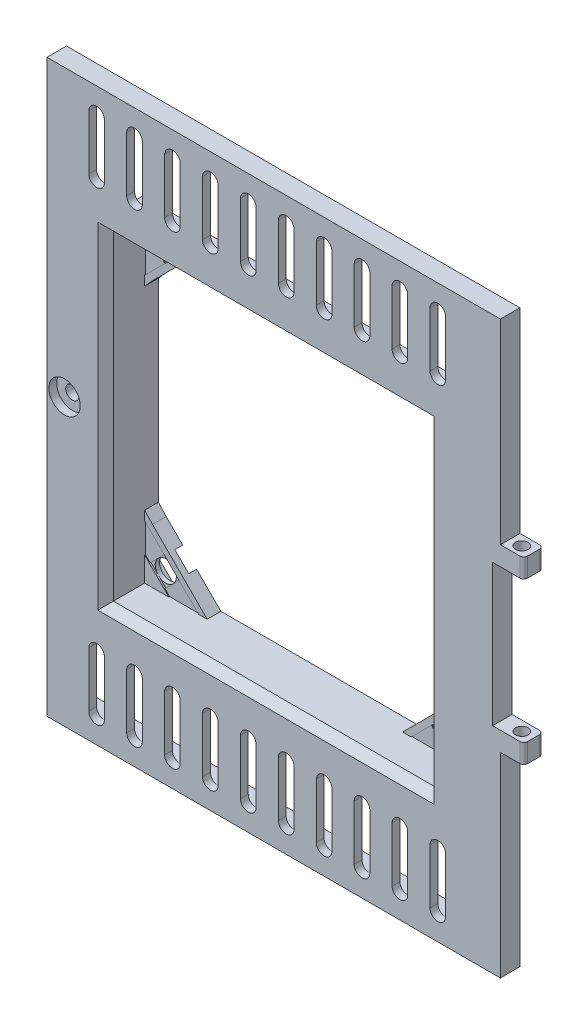
from build123d import *

# Parameters (mm, degrees)
BOSS_EXTRUDE1_DEPTH     = 5
SKETCH2_W               = 5
SKETCH2_H               = 4.9
BOSS_EXTRUDE2_DEPTH     = 6
FILLET1_R               = 1
CUT_EXTRUDE1_DEPTH      = 73
CUT_EXTRUDE1_DEPTH_BACK = 56
SKETCH3_R               = 1.6
SHELL1_START            = 6.108408335
SHELL1_OUTLINE_W        = 112
SHELL1_OUTLINE_H        = 3
SHELL1_DEPTH            = 142
SHELL1_START_2          = 56.108408335
SHELL1_2_DEPTH          = 0.9
SHELL1_START_3          = 97.208408335
SHELL1_3_DEPTH          = 0.9
SKETCH4_R               = 1.7
CUT_EXTRUDE2_DEPTH      = 52
BOSS_EXTRUDE3_START     = 3
SKETCH5_W               = 8
SKETCH5_H               = 10
SKETCH5_R               = 1.7
BOSS_EXTRUDE3_DEPTH     = 3
SKETCH6_R               = 4
CUT_EXTRUDE3_DEPTH      = 2
CHAMFER1_SIZE           = 1
SKETCH7_W               = 86
SKETCH7_H               = 86
SKETCH7_W_2             = 82
SKETCH7_H_2             = 82
BOSS_EXTRUDE4_DEPTH     = 11.5
SKETCH8_R               = 2.7
BOSS_EXTRUDE5_DEPTH     = 3.5
CUT_EXTRUDE4_DEPTH      = 2
CHAMFER2_SIZE           = 5
CHAMFER3_SIZE           = 2
SKETCH10_W              = 82
SKETCH10_H              = 82
CUT_EXTRUDE7_DEPTH      = 2
CHAMFER4_SIZE           = 2
CUT_EXTRUDE8_DEPTH      = 6
SKETCH12_W              = 2
SKETCH12_H              = 54.2
BOSS_EXTRUDE6_DEPTH     = 3
CHAMFER5_SIZE           = 2
CUT_EXTRUDE9_DEPTH      = 12
CUT_EXTRUDE10_DEPTH     = 0.2
CUT_EXTRUDE11_DEPTH     = 0.2
BOSS_EXTRUDE7_DEPTH     = 4


# Read off the part's stored shape, not the designer's step: Shell1
# Some blends are built 0.0001 mm under size
with BuildPart() as part:
    # Sketch1 → Boss-Extrude1 (new body)
    with BuildSketch(Plane.XY.offset(159.876343068)):
        Polygon((73.974778316, 54.108408335), (73.974778316, 4.108408335), (-42.025221684, 4.108408335), (-42.025221684, 150.108408335), (73.974778316, 150.108408335), (73.974778316, 100.108408335), align=None)
    extrude(amount=BOSS_EXTRUDE1_DEPTH)

    # Sketch2 → Boss-Extrude2 (add)
    with BuildSketch(Plane(origin=(73.974778316, 0, 0), x_dir=(0, 0, -1), z_dir=(1, 0, 0))):
        with Locations((-162.376343068, 97.658408335)):
            Rectangle(SKETCH2_W, SKETCH2_H)
        with Locations((-162.376343068, 56.558408335)):
            Rectangle(SKETCH2_W, SKETCH2_H)
    extrude(amount=BOSS_EXTRUDE2_DEPTH)

    # Fillet1
    fillet1_edges = [part.edges().sort_by_distance(p)[0] for p in [
        (79.974778316, 97.658408335, 164.876343068),
        (79.974778316, 97.658408335, 159.876343068),
        (73.974778316, 77.108408335, 159.876343068),
        (73.974778316, 77.108408335, 164.876343068),
        (79.974778316, 56.558408335, 164.876343068),
        (79.974778316, 56.558408335, 159.876343068),
    ]]
    fillet(fillet1_edges, radius=FILLET1_R)

    # Sketch3 → Cut-Extrude1 (cut, two sides: drawn at the far end of the back side and taken through both)
    with BuildSketch(Plane(origin=(0, 95.208408335, 0), x_dir=(-1, 0, 0), z_dir=(0, -1, 0)).offset(-CUT_EXTRUDE1_DEPTH_BACK)):
        with Locations(Location((-76.974778316, -162.376343068, 0), (0, 0, 270))):
            Circle(SKETCH3_R)
    extrude(amount=CUT_EXTRUDE1_DEPTH + CUT_EXTRUDE1_DEPTH_BACK, mode=Mode.SUBTRACT)

    # Shell1 outline → Shell1 (cut)
    with BuildSketch(Plane(origin=(0, 0, 0), x_dir=(1, 0, 0), z_dir=(0, 1, 0)).offset(SHELL1_START)):
        with Locations((15.974778316, -161.376343068)):
            Rectangle(SHELL1_OUTLINE_W, SHELL1_OUTLINE_H)
    extrude(amount=SHELL1_DEPTH, mode=Mode.SUBTRACT)

    # Shell1 2 outline → Shell1 2 (cut)
    with BuildSketch(Plane(origin=(0, 0, 0), x_dir=(1, 0, 0), z_dir=(0, 1, 0)).offset(SHELL1_START_2)):
        with BuildLine():
            Line((74.384411547, -159.876343068), (71.974778316, -159.876343068))
            Line((71.974778316, -159.876343068), (71.974778316, -162.876343068))
            Line((71.974778316, -162.876343068), (73.409669622, -162.876343068))
            ThreePointArc((73.409669622, -162.876343068), (73.5509691, -161.263899606), (74.384411547, -159.876343068))
        make_face()
    extrude(amount=SHELL1_2_DEPTH, mode=Mode.SUBTRACT)

    # Shell1 3 outline → Shell1 3 (cut)
    with BuildSketch(Plane(origin=(0, 0, 0), x_dir=(1, 0, 0), z_dir=(0, 1, 0)).offset(SHELL1_START_3)):
        with BuildLine():
            Line((74.384411547, -159.876343068), (71.974778316, -159.876343068))
            Line((71.974778316, -159.876343068), (71.974778316, -162.876343068))
            Line((71.974778316, -162.876343068), (73.409669622, -162.876343068))
            ThreePointArc((73.409669622, -162.876343068), (73.5509691, -161.263899606), (74.384411547, -159.876343068))
        make_face()
    extrude(amount=SHELL1_3_DEPTH, mode=Mode.SUBTRACT)

    # Sketch4 → Cut-Extrude2 (cut)
    with BuildSketch(Plane(origin=(0, 0, 162.876343068), x_dir=(-1, 0, 0), z_dir=(0, 0, -1))):
        with Locations((37.525221684, 77.108408335)):
            Circle(SKETCH4_R)
    extrude(amount=-CUT_EXTRUDE2_DEPTH, mode=Mode.SUBTRACT)

    # Sketch5 → Boss-Extrude3 (add)
    with BuildSketch(Plane(origin=(0, 0, 162.876343068), x_dir=(-1, 0, 0), z_dir=(0, 0, -1)).offset(BOSS_EXTRUDE3_START)):
        with Locations((36.025221684, 77.108408335)):
            Rectangle(SKETCH5_W, SKETCH5_H)
        with Locations((37.525221684, 77.108408335)):
            Circle(SKETCH5_R, mode=Mode.SUBTRACT)
    extrude(amount=-BOSS_EXTRUDE3_DEPTH)

    # Sketch6 → Cut-Extrude3 (cut)
    with BuildSketch(Plane.XY.offset(164.876343068)):
        with Locations((-37.525221684, 77.108408335)):
            Circle(SKETCH6_R)
    extrude(amount=-CUT_EXTRUDE3_DEPTH, mode=Mode.SUBTRACT)

    # Chamfer1
    chamfer1_edges = [part.edges().sort_by_distance(p)[0] for p in [
        (-40.025221684, 72.108408335, 161.376343068),
        (-40.025221684, 82.108408335, 161.376343068),
        (-32.025221684, 82.108408335, 161.376343068),
        (-32.025221684, 72.108408335, 161.376343068),
    ]]
    chamfer(chamfer1_edges, length=CHAMFER1_SIZE)

    # Sketch7 → Boss-Extrude4 (add)
    with BuildSketch(Plane(origin=(0, 0, 162.876343068), x_dir=(-1, 0, 0), z_dir=(0, 0, -1))):
        with Locations((-13.974778316, 77.108408335)):
            Rectangle(SKETCH7_W, SKETCH7_H)
        with Locations((-13.974778316, 77.108408335)):
            Rectangle(SKETCH7_W_2, SKETCH7_H_2, mode=Mode.SUBTRACT)
    extrude(amount=BOSS_EXTRUDE4_DEPTH)

    # Sketch8 → Boss-Extrude5 (add)
    # profile 1 of 4: a face of its own
    with BuildSketch(Plane(origin=(0, 0, 151.376343068), x_dir=(-1, 0, 0), z_dir=(0, 0, -1))):
        Polygon((-54.974778316, 118.108408335), (-40.974778316, 118.108408335), (-38.974778316, 118.108408335), (-40.974778316, 116.108408335), (-52.974778316, 104.108408335), (-54.974778316, 102.108408335), (-54.974778316, 104.108408335), align=None)
        with Locations((-49.974778316, 113.108408335)):
            Circle(SKETCH8_R, mode=Mode.SUBTRACT)
    # profile 2 of 4: a face of its own
    with BuildSketch(Plane(origin=(0, 0, 151.376343068), x_dir=(-1, 0, 0), z_dir=(0, 0, -1))):
        Polygon((25.025221684, 104.108408335), (13.025221684, 116.108408335), (11.025221684, 118.108408335), (13.025221684, 118.108408335), (27.025221684, 118.108408335), (27.025221684, 104.108408335), (27.025221684, 101.897049153), align=None)
        with Locations(Location((22.025221684, 113.108408335, 0), (0, 0, 180))):
            Circle(SKETCH8_R, mode=Mode.SUBTRACT)
    # profile 3 of 4: a face of its own
    with BuildSketch(Plane(origin=(0, 0, 151.376343068), x_dir=(-1, 0, 0), z_dir=(0, 0, -1))):
        Polygon((27.025221684, 36.108408335), (27.025221684, 50.108408335), (27.025221684, 52.27376362), (25.025221684, 50.108408335), (13.025221684, 38.108408335), (11.025221684, 36.108408335), (13.025221684, 36.108408335), align=None)
        with Locations((22.025221684, 41.108408335)):
            Circle(SKETCH8_R, mode=Mode.SUBTRACT)
    # profile 4 of 4: a face of its own
    with BuildSketch(Plane(origin=(0, 0, 151.376343068), x_dir=(-1, 0, 0), z_dir=(0, 0, -1))):
        Polygon((-52.974778316, 50.108408335), (-40.974778316, 38.108408335), (-38.974778316, 36.108408335), (-40.974778316, 36.108408335), (-54.974778316, 36.108408335), (-54.974778316, 50.108408335), (-54.974778316, 52.108408335), align=None)
        with Locations(Location((-49.974778316, 41.108408335, 0), (0, 0, 180))):
            Circle(SKETCH8_R, mode=Mode.SUBTRACT)
    extrude(amount=-BOSS_EXTRUDE5_DEPTH)

    # Sketch9 → Cut-Extrude4 (cut)
    with BuildSketch(Plane(origin=(0, 0, 151.376343068), x_dir=(-1, 0, 0), z_dir=(0, 0, -1))):
        Polygon((-46.463843018, 116.619343633), (-51.259869826, 117.904435143), (-54.770805124, 114.393499845), (-53.485713614, 109.597473037), (-48.689686806, 108.312381527), (-45.178751508, 111.823316825), align=None)
        Polygon((17.229194876, 111.823316825), (18.514286386, 116.619343633), (23.310313194, 117.904435143), (26.821248492, 114.393499845), (25.536156982, 109.597473037), (20.740130174, 108.312381527), align=None)
        Polygon((18.514286386, 37.597473037), (23.310313194, 36.312381527), (26.821248492, 39.823316825), (25.536156982, 44.619343633), (20.740130174, 45.904435143), (17.229194876, 42.393499845), align=None)
        Polygon((-45.178751508, 42.393499845), (-46.463843018, 37.597473037), (-51.259869826, 36.312381527), (-54.770805124, 39.823316825), (-53.485713614, 44.619343633), (-48.689686806, 45.904435143), align=None)
    extrude(amount=-CUT_EXTRUDE4_DEPTH, mode=Mode.SUBTRACT)

    # Chamfer2
    # the kernel refuses this chamfer: 5 mm, written as the material it adds along each edge
    with BuildSketch(Plane(origin=(56.974778316, 120.108408335, 162.876343068), x_dir=(0, 0.9996219169127715, 0.02749587655697328), z_dir=(-1, 0, 0)), Plane(origin=(-29.025221684, 120.108408335, 162.876343068), x_dir=(-0.9996219169127715, 0, 0.027495876556973334), z_dir=(0, -1, 0)), Plane(origin=(56.974778316, 34.108408335, 162.876343068), x_dir=(0.9996219169127715, 0, 0.027495876556973355), z_dir=(0, 1, 0)), Plane(origin=(-29.025221684, 34.108408335, 162.876343068), x_dir=(0, -0.9996219169127715, 0.027495876556973334), z_dir=(1, 0, 0))) as chamfer2_piece_1:
        Polygon((CHAMFER2_SIZE * 0.999621916911, CHAMFER2_SIZE * 0.0274958766114), (-CHAMFER2_SIZE * 0.027495876557, CHAMFER2_SIZE * 0.999621916913), (0, 0), align=None)
    extrude(amount=86)
    with BuildSketch(Plane(origin=(56.974778316, 34.108408335, 162.876343068), x_dir=(0.9996219169127715, 0, 0.027495876556973355), z_dir=(0, 1, 0))) as chamfer2_piece_2a_section:
        Polygon((CHAMFER2_SIZE * 0.999621916911, CHAMFER2_SIZE * 0.0274958766114), (-CHAMFER2_SIZE * 0.027495876557, CHAMFER2_SIZE * 0.999621916913), (0, 0), align=None)
    chamfer2_piece_2a = extrude(amount=98.85841494, mode=Mode.PRIVATE)
    chamfer2_piece_2a = split(chamfer2_piece_2a, bisect_by=Plane(origin=(58.62374645, 120.108408335, 161.227374934), z_dir=(0, 1, 0)), keep=Keep.TOP, mode=Mode.PRIVATE)
    with BuildSketch(Plane(origin=(69.833193256, 120.108408335, 162.876343068), x_dir=(0, 0.9996219169112968, 0.027495876610587663), z_dir=(-1, 0, 0))) as chamfer2_piece_2b_section:
        Polygon((CHAMFER2_SIZE * 0.999621916911, CHAMFER2_SIZE * 0.0274958766106), (-CHAMFER2_SIZE * 0.0274958766106, CHAMFER2_SIZE * 0.999621916911), (0, 0), align=None)
    chamfer2_piece_2b = extrude(amount=98.85841494, mode=Mode.PRIVATE)
    chamfer2_piece_2b = split(chamfer2_piece_2b, bisect_by=Plane(origin=(56.974778316, 121.757376469, 161.227374934), z_dir=(1, 0, 0)), keep=Keep.TOP, mode=Mode.PRIVATE)
    chamfer2_piece_2 = chamfer2_piece_2a & chamfer2_piece_2b
    add(chamfer2_piece_2)
    with BuildSketch(Plane(origin=(-29.025221684, 132.966823275, 162.876343068), x_dir=(-0.9996219169112968, 0, 0.02749587661058768), z_dir=(0, -1, 0))) as chamfer2_piece_3a_section:
        Polygon((CHAMFER2_SIZE * 0.999621916911, CHAMFER2_SIZE * 0.0274958766106), (-CHAMFER2_SIZE * 0.0274958766106, CHAMFER2_SIZE * 0.999621916911), (0, 0), align=None)
    chamfer2_piece_3a = extrude(amount=98.85841494, mode=Mode.PRIVATE)
    chamfer2_piece_3a = split(chamfer2_piece_3a, bisect_by=Plane(origin=(-30.674189818, 120.108408335, 161.227374934), z_dir=(0, 1, 0)), keep=Keep.TOP, mode=Mode.PRIVATE)
    with BuildSketch(Plane(origin=(56.974778316, 120.108408335, 162.876343068), x_dir=(0, 0.9996219169127715, 0.02749587655697328), z_dir=(-1, 0, 0))) as chamfer2_piece_3b_section:
        Polygon((CHAMFER2_SIZE * 0.999621916911, CHAMFER2_SIZE * 0.0274958766114), (-CHAMFER2_SIZE * 0.027495876557, CHAMFER2_SIZE * 0.999621916913), (0, 0), align=None)
    chamfer2_piece_3b = extrude(amount=98.85841494, mode=Mode.PRIVATE)
    chamfer2_piece_3b = split(chamfer2_piece_3b, bisect_by=Plane(origin=(-29.025221684, 121.757376469, 161.227374934), z_dir=(-1, 0, 0)), keep=Keep.TOP, mode=Mode.PRIVATE)
    chamfer2_piece_3 = chamfer2_piece_3a & chamfer2_piece_3b
    add(chamfer2_piece_3)
    with BuildSketch(Plane(origin=(-41.883636624, 34.108408335, 162.876343068), x_dir=(0, -0.9996219169112968, 0.0274958766105877), z_dir=(1, 0, 0))) as chamfer2_piece_4a_section:
        Polygon((CHAMFER2_SIZE * 0.999621916911, CHAMFER2_SIZE * 0.0274958766106), (-CHAMFER2_SIZE * 0.0274958766106, CHAMFER2_SIZE * 0.999621916911), (0, 0), align=None)
    chamfer2_piece_4a = extrude(amount=98.85841494, mode=Mode.PRIVATE)
    chamfer2_piece_4a = split(chamfer2_piece_4a, bisect_by=Plane(origin=(-29.025221684, 32.459440201, 161.227374934), z_dir=(-1, 0, 0)), keep=Keep.TOP, mode=Mode.PRIVATE)
    with BuildSketch(Plane(origin=(-29.025221684, 120.108408335, 162.876343068), x_dir=(-0.9996219169127715, 0, 0.027495876556973334), z_dir=(0, -1, 0))) as chamfer2_piece_4b_section:
        Polygon((CHAMFER2_SIZE * 0.999621916911, CHAMFER2_SIZE * 0.0274958766114), (-CHAMFER2_SIZE * 0.027495876557, CHAMFER2_SIZE * 0.999621916913), (0, 0), align=None)
    chamfer2_piece_4b = extrude(amount=98.85841494, mode=Mode.PRIVATE)
    chamfer2_piece_4b = split(chamfer2_piece_4b, bisect_by=Plane(origin=(-30.674189818, 34.108408335, 161.227374934), z_dir=(0, -1, 0)), keep=Keep.TOP, mode=Mode.PRIVATE)
    chamfer2_piece_4 = chamfer2_piece_4a & chamfer2_piece_4b
    add(chamfer2_piece_4)
    with BuildSketch(Plane(origin=(56.974778316, 21.249993395, 162.876343068), x_dir=(0.9996219169112968, 0, 0.0274958766105877), z_dir=(0, 1, 0))) as chamfer2_piece_5a_section:
        Polygon((CHAMFER2_SIZE * 0.999621916911, CHAMFER2_SIZE * 0.0274958766106), (-CHAMFER2_SIZE * 0.0274958766106, CHAMFER2_SIZE * 0.999621916911), (0, 0), align=None)
    chamfer2_piece_5a = extrude(amount=98.85841494, mode=Mode.PRIVATE)
    chamfer2_piece_5a = split(chamfer2_piece_5a, bisect_by=Plane(origin=(58.62374645, 34.108408335, 161.227374934), z_dir=(0, -1, 0)), keep=Keep.TOP, mode=Mode.PRIVATE)
    with BuildSketch(Plane(origin=(-29.025221684, 34.108408335, 162.876343068), x_dir=(0, -0.9996219169127715, 0.027495876556973334), z_dir=(1, 0, 0))) as chamfer2_piece_5b_section:
        Polygon((CHAMFER2_SIZE * 0.999621916911, CHAMFER2_SIZE * 0.0274958766114), (-CHAMFER2_SIZE * 0.027495876557, CHAMFER2_SIZE * 0.999621916913), (0, 0), align=None)
    chamfer2_piece_5b = extrude(amount=98.85841494, mode=Mode.PRIVATE)
    chamfer2_piece_5b = split(chamfer2_piece_5b, bisect_by=Plane(origin=(56.974778316, 32.459440201, 161.227374934), z_dir=(1, 0, 0)), keep=Keep.TOP, mode=Mode.PRIVATE)
    chamfer2_piece_5 = chamfer2_piece_5a & chamfer2_piece_5b
    add(chamfer2_piece_5)

    # Chamfer3
    chamfer3_edges = [part.edges().sort_by_distance(p)[0] for p in [
        (56.974778316, 77.108408335, 151.376343068),
        (13.974778316, 34.108408335, 151.376343068),
        (-29.025221684, 77.108408335, 151.376343068),
        (13.974778316, 120.108408335, 151.376343068),
    ]]
    chamfer(chamfer3_edges, length=CHAMFER3_SIZE - 0.0001)  # a hair under: the kernel refuses the full size

    # Sketch10 → Cut-Extrude7 (cut)
    with BuildSketch(Plane.XY.offset(164.876343068)):
        with Locations((13.974778316, 77.108408335)):
            Rectangle(SKETCH10_W, SKETCH10_H)
    extrude(amount=-CUT_EXTRUDE7_DEPTH, mode=Mode.SUBTRACT)

    # Chamfer4
    chamfer4_edges = [part.edges().sort_by_distance(p)[0] for p in [
        (54.974778316, 77.108408335, 164.876343068),
        (13.974778316, 118.108408335, 164.876343068),
        (-27.025221684, 77.108408335, 164.876343068),
        (13.974778316, 36.108408335, 164.876343068),
    ]]
    chamfer(chamfer4_edges, length=CHAMFER4_SIZE)

    # Sketch11 → Cut-Extrude8 (cut, symmetric)
    with BuildSketch(Plane(origin=(0, 0, 162.876343068), x_dir=(-1, 0, 0), z_dir=(0, 0, -1))):
        Polygon((-75.974778316, 95.208408335), (-72.974778316, 95.208408335), (-71.974778316, 95.208408335), (-71.974778316, 59.008408335), (-73.474778316, 59.008408335), (-75.974778316, 59.008408335), align=None)
    extrude(amount=CUT_EXTRUDE8_DEPTH, both=True, mode=Mode.SUBTRACT)

    # Sketch12 → Boss-Extrude6 (add)
    with BuildSketch(Plane(origin=(0, 0, 162.876343068), x_dir=(-1, 0, 0), z_dir=(0, 0, -1))):
        with Locations((-70.974778316, 77.008408335)):
            Rectangle(SKETCH12_W, SKETCH12_H)
    extrude(amount=BOSS_EXTRUDE6_DEPTH)

    # Chamfer5
    chamfer5_edges = [part.edges().sort_by_distance(p)[0] for p in [
        (71.974778316, 104.108408335, 161.376343068),
        (71.974778316, 49.908408335, 161.376343068),
    ]]
    chamfer(chamfer5_edges, length=CHAMFER5_SIZE - 0.0001)  # a hair under: the kernel refuses the full size

    # Sketch13 → Cut-Extrude9 (cut)
    with BuildSketch(Plane(origin=(0, 0, 162.876343068), x_dir=(-1, 0, 0), z_dir=(0, 0, -1))):
        with BuildLine():
            Line((-59.974778316, 129.608408335), (-59.974778316, 143.608408335))
            ThreePointArc((-59.974778316, 143.608408335), (-57.974778316, 145.608408335), (-55.974778316, 143.608408335))
            Line((-55.974778316, 143.608408335), (-55.974778316, 129.608408335))
            ThreePointArc((-55.974778316, 129.608408335), (-57.974778316, 127.608408335), (-59.974778316, 129.608408335))
        make_face()
        with BuildLine():
            Line((-50.274778316, 129.608408335), (-50.274778316, 143.608408335))
            ThreePointArc((-50.274778316, 143.608408335), (-48.274778316, 145.608408335), (-46.274778316, 143.608408335))
            Line((-46.274778316, 143.608408335), (-46.274778316, 129.608408335))
            ThreePointArc((-46.274778316, 129.608408335), (-48.274778316, 127.608408335), (-50.274778316, 129.608408335))
        make_face()
        with BuildLine():
            Line((-40.574778316, 129.608408335), (-40.574778316, 143.608408335))
            ThreePointArc((-40.574778316, 143.608408335), (-38.574778316, 145.608408335), (-36.574778316, 143.608408335))
            Line((-36.574778316, 143.608408335), (-36.574778316, 129.608408335))
            ThreePointArc((-36.574778316, 129.608408335), (-38.574778316, 127.608408335), (-40.574778316, 129.608408335))
        make_face()
        with BuildLine():
            Line((-30.874778316, 129.608408335), (-30.874778316, 143.608408335))
            ThreePointArc((-30.874778316, 143.608408335), (-28.874778316, 145.608408335), (-26.874778316, 143.608408335))
            Line((-26.874778316, 143.608408335), (-26.874778316, 129.608408335))
            ThreePointArc((-26.874778316, 129.608408335), (-28.874778316, 127.608408335), (-30.874778316, 129.608408335))
        make_face()
        with BuildLine():
            Line((-21.174778316, 129.608408335), (-21.174778316, 143.608408335))
            ThreePointArc((-21.174778316, 143.608408335), (-19.174778316, 145.608408335), (-17.174778316, 143.608408335))
            Line((-17.174778316, 143.608408335), (-17.174778316, 129.608408335))
            ThreePointArc((-17.174778316, 129.608408335), (-19.174778316, 127.608408335), (-21.174778316, 129.608408335))
        make_face()
        with BuildLine():
            Line((-11.474778316, 129.608408335), (-11.474778316, 143.608408335))
            ThreePointArc((-11.474778316, 143.608408335), (-9.474778316, 145.608408335), (-7.474778316, 143.608408335))
            Line((-7.474778316, 143.608408335), (-7.474778316, 129.608408335))
            ThreePointArc((-7.474778316, 129.608408335), (-9.474778316, 127.608408335), (-11.474778316, 129.608408335))
        make_face()
        with BuildLine():
            Line((-1.774778316, 129.608408335), (-1.774778316, 143.608408335))
            ThreePointArc((-1.774778316, 143.608408335), (0.225221684, 145.608408335), (2.225221684, 143.608408335))
            Line((2.225221684, 143.608408335), (2.225221684, 129.608408335))
            ThreePointArc((2.225221684, 129.608408335), (0.225221684, 127.608408335), (-1.774778316, 129.608408335))
        make_face()
        with BuildLine():
            Line((7.925221684, 129.608408335), (7.925221684, 143.608408335))
            ThreePointArc((7.925221684, 143.608408335), (9.925221684, 145.608408335), (11.925221684, 143.608408335))
            Line((11.925221684, 143.608408335), (11.925221684, 129.608408335))
            ThreePointArc((11.925221684, 129.608408335), (9.925221684, 127.608408335), (7.925221684, 129.608408335))
        make_face()
        with BuildLine():
            Line((17.625221684, 129.608408335), (17.625221684, 143.608408335))
            ThreePointArc((17.625221684, 143.608408335), (19.625221684, 145.608408335), (21.625221684, 143.608408335))
            Line((21.625221684, 143.608408335), (21.625221684, 129.608408335))
            ThreePointArc((21.625221684, 129.608408335), (19.625221684, 127.608408335), (17.625221684, 129.608408335))
        make_face()
        with BuildLine():
            Line((27.325221684, 129.608408335), (27.325221684, 143.608408335))
            ThreePointArc((27.325221684, 143.608408335), (29.325221684, 145.608408335), (31.325221684, 143.608408335))
            Line((31.325221684, 143.608408335), (31.325221684, 129.608408335))
            ThreePointArc((31.325221684, 129.608408335), (29.325221684, 127.608408335), (27.325221684, 129.608408335))
        make_face()
        with BuildLine():
            Line((-59.974778316, 24.608408335), (-59.974778316, 10.608408335))
            ThreePointArc((-59.974778316, 10.608408335), (-57.974778316, 8.608408335), (-55.974778316, 10.608408335))
            Line((-55.974778316, 10.608408335), (-55.974778316, 24.608408335))
            ThreePointArc((-55.974778316, 24.608408335), (-57.974778316, 26.608408335), (-59.974778316, 24.608408335))
        make_face()
        with BuildLine():
            Line((-50.274778316, 24.608408335), (-50.274778316, 10.608408335))
            ThreePointArc((-50.274778316, 10.608408335), (-48.274778316, 8.608408335), (-46.274778316, 10.608408335))
            Line((-46.274778316, 10.608408335), (-46.274778316, 24.608408335))
            ThreePointArc((-46.274778316, 24.608408335), (-48.274778316, 26.608408335), (-50.274778316, 24.608408335))
        make_face()
        with BuildLine():
            Line((-40.574778316, 24.608408335), (-40.574778316, 10.608408335))
            ThreePointArc((-40.574778316, 10.608408335), (-38.574778316, 8.608408335), (-36.574778316, 10.608408335))
            Line((-36.574778316, 10.608408335), (-36.574778316, 24.608408335))
            ThreePointArc((-36.574778316, 24.608408335), (-38.574778316, 26.608408335), (-40.574778316, 24.608408335))
        make_face()
        with BuildLine():
            Line((-30.874778316, 24.608408335), (-30.874778316, 10.608408335))
            ThreePointArc((-30.874778316, 10.608408335), (-28.874778316, 8.608408335), (-26.874778316, 10.608408335))
            Line((-26.874778316, 10.608408335), (-26.874778316, 24.608408335))
            ThreePointArc((-26.874778316, 24.608408335), (-28.874778316, 26.608408335), (-30.874778316, 24.608408335))
        make_face()
        with BuildLine():
            Line((-21.174778316, 24.608408335), (-21.174778316, 10.608408335))
            ThreePointArc((-21.174778316, 10.608408335), (-19.174778316, 8.608408335), (-17.174778316, 10.608408335))
            Line((-17.174778316, 10.608408335), (-17.174778316, 24.608408335))
            ThreePointArc((-17.174778316, 24.608408335), (-19.174778316, 26.608408335), (-21.174778316, 24.608408335))
        make_face()
        with BuildLine():
            Line((-11.474778316, 24.608408335), (-11.474778316, 10.608408335))
            ThreePointArc((-11.474778316, 10.608408335), (-9.474778316, 8.608408335), (-7.474778316, 10.608408335))
            Line((-7.474778316, 10.608408335), (-7.474778316, 24.608408335))
            ThreePointArc((-7.474778316, 24.608408335), (-9.474778316, 26.608408335), (-11.474778316, 24.608408335))
        make_face()
        with BuildLine():
            Line((-1.774778316, 24.608408335), (-1.774778316, 10.608408335))
            ThreePointArc((-1.774778316, 10.608408335), (0.225221684, 8.608408335), (2.225221684, 10.608408335))
            Line((2.225221684, 10.608408335), (2.225221684, 24.608408335))
            ThreePointArc((2.225221684, 24.608408335), (0.225221684, 26.608408335), (-1.774778316, 24.608408335))
        make_face()
        with BuildLine():
            Line((7.925221684, 24.608408335), (7.925221684, 10.608408335))
            ThreePointArc((7.925221684, 10.608408335), (9.925221684, 8.608408335), (11.925221684, 10.608408335))
            Line((11.925221684, 10.608408335), (11.925221684, 24.608408335))
            ThreePointArc((11.925221684, 24.608408335), (9.925221684, 26.608408335), (7.925221684, 24.608408335))
        make_face()
        with BuildLine():
            Line((17.625221684, 24.608408335), (17.625221684, 10.608408335))
            ThreePointArc((17.625221684, 10.608408335), (19.625221684, 8.608408335), (21.625221684, 10.608408335))
            Line((21.625221684, 10.608408335), (21.625221684, 24.608408335))
            ThreePointArc((21.625221684, 24.608408335), (19.625221684, 26.608408335), (17.625221684, 24.608408335))
        make_face()
        with BuildLine():
            Line((27.325221684, 24.608408335), (27.325221684, 10.608408335))
            ThreePointArc((27.325221684, 10.608408335), (29.325221684, 8.608408335), (31.325221684, 10.608408335))
            Line((31.325221684, 10.608408335), (31.325221684, 24.608408335))
            ThreePointArc((31.325221684, 24.608408335), (29.325221684, 26.608408335), (27.325221684, 24.608408335))
        make_face()
    extrude(amount=-CUT_EXTRUDE9_DEPTH, mode=Mode.SUBTRACT)

    # Sketch14 → Cut-Extrude10 (cut)
    with BuildSketch(Plane.XY.offset(154.876343068)):
        Polygon((-20.825221684, 118.108408335), (-27.025221684, 111.908408335), (-27.025221684, 104.308408335), (-13.225221684, 118.108408335), align=None)
        Polygon((54.974778316, 104.308408335), (41.174778316, 118.108408335), (48.774778316, 118.108408335), (54.974778316, 111.908408335), align=None)
        Polygon((48.774778316, 36.108408335), (54.974778316, 42.308408335), (54.974778316, 49.908408335), (41.174778316, 36.108408335), align=None)
        Polygon((-27.025221684, 49.908408335), (-13.225221684, 36.108408335), (-20.825221684, 36.108408335), (-27.025221684, 42.308408335), align=None)
    extrude(amount=-CUT_EXTRUDE10_DEPTH, mode=Mode.SUBTRACT)

    # Sketch16 → Cut-Extrude11 (cut)
    with BuildSketch(Plane.XY.offset(154.676343068)):
        Polygon((-23.934409993, 111.199220026), (-22.034409993, 109.299220026), (-18.216033375, 113.117596644), (-20.116033375, 115.017596644), (-22.016033375, 116.917596644), (-25.834409993, 113.099220026), align=None)
        Polygon((46.165590007, 113.117596644), (49.983966625, 109.299220026), (51.883966625, 111.199220026), (53.783966625, 113.099220026), (49.965590007, 116.917596644), (48.065590007, 115.017596644), align=None)
        Polygon((51.883966625, 43.017596644), (49.983966625, 44.917596644), (46.165590007, 41.099220026), (48.065590007, 39.199220026), (49.965590007, 37.299220026), (53.783966625, 41.117596644), align=None)
        Polygon((-18.216033375, 41.099220026), (-22.034409993, 44.917596644), (-23.934409993, 43.017596644), (-25.834409993, 41.117596644), (-22.016033375, 37.299220026), (-20.116033375, 39.199220026), align=None)
    extrude(amount=-CUT_EXTRUDE11_DEPTH, mode=Mode.SUBTRACT)

    # Sketch17 → Boss-Extrude7 (add)
    with BuildSketch(Plane(origin=(0, 0, 162.876343068), x_dir=(-1, 0, 0), z_dir=(0, 0, -1))):
        Polygon((37.525221684, 72.108408335), (37.525221684, 8.608408335), (-69.474778316, 8.608408335), (-69.474778316, 22.108408335), (-69.474778316, 24.108408335), (-69.474778316, 59.108408335), (-69.474778316, 69.108408335), (-69.474778316, 85.108408335), (-69.474778316, 95.108408335), (-69.474778316, 130.108408335), (-69.474778316, 132.108408335), (-69.474778316, 145.608408335), (37.525221684, 145.608408335), (37.525221684, 82.108408335), (38.525221684, 82.108408335), (38.525221684, 146.608408335), (-70.474778316, 146.608408335), (-70.474778316, 132.108408335), (-70.474778316, 130.108408335), (-70.474778316, 95.108408335), (-70.474778316, 85.108408335), (-70.474778316, 69.108408335), (-70.474778316, 59.108408335), (-70.474778316, 24.108408335), (-70.474778316, 22.108408335), (-70.474778316, 7.608408335), (38.525221684, 7.608408335), (38.525221684, 72.108408335), align=None)
    extrude(amount=BOSS_EXTRUDE7_DEPTH)


solid = part.part
